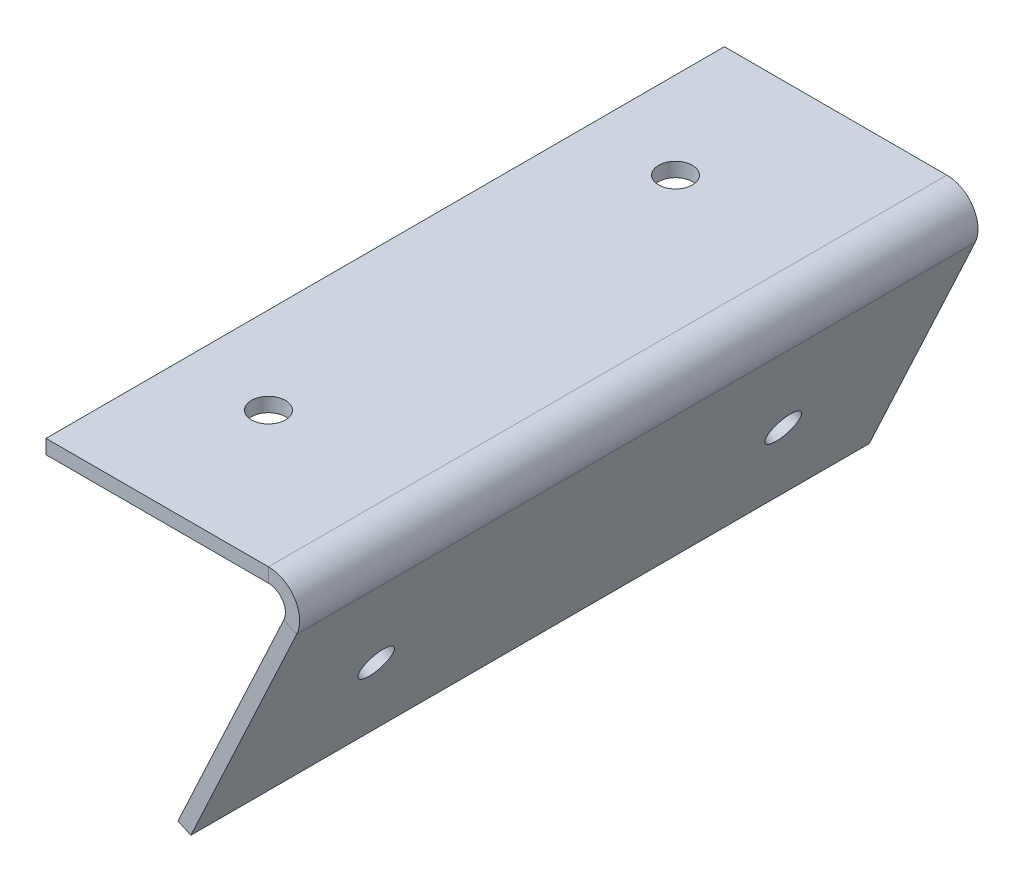
from build123d import *

# Parameters (mm, degrees)
BASE_FLANGE1_DEPTH = 127
CUT_EXTRUDE1_REACH = 146.789
SKETCH6_R          = 3.175
CUT_EXTRUDE2_REACH = 139.304
SKETCH7_R          = 3.175


# Read off the part's stored shape, not the designer's step: Base-Flange1
with BuildPart() as part:
    # Base-Flange1 outline → Base-Flange1 (new body)
    with BuildSketch(Plane.XY):
        with BuildLine():
            Line((44.523372088, -7.173652981), (24.703656185, -49.677170897))
            Line((24.703656185, -49.677170897), (27.111570966, -50.8))
            Line((27.111570966, -50.8), (46.931286869, -8.296482084))
            ThreePointArc((46.931286869, -8.296482084), (46.564368833, -2.698394652), (41.645844864, 0))
            Line((41.645844864, 0), (0, 0))
            Line((0, 0), (0, -2.65684))
            Line((0, -2.65684), (41.645844864, -2.65684))
            ThreePointArc((41.645844864, -2.65684), (44.323612704, -4.125913744), (44.523372088, -7.173652981))
        make_face()
    extrude(amount=BASE_FLANGE1_DEPTH)

    # Sketch6 → Cut-Extrude1 (cut, up to next)
    with BuildSketch(Plane(origin=(0, 0, 0), x_dir=(1, 0, 0), z_dir=(0, 1, 0)), mode=Mode.PRIVATE) as cut_extrude1_sk1:
        with Locations(Location((16.245844864, -101.6, 0), (0, 0, 270))):
            Circle(SKETCH6_R)
    cut_extrude1_tool1 = extrude(cut_extrude1_sk1.sketch, amount=-CUT_EXTRUDE1_REACH, mode=Mode.PRIVATE) & part.part
    # Sketch6 → Cut-Extrude1 (cut, up to next)
    with BuildSketch(Plane(origin=(0, 0, 0), x_dir=(1, 0, 0), z_dir=(0, 1, 0)), mode=Mode.PRIVATE) as cut_extrude1_sk2:
        with Locations(Location((16.245844864, -25.4, 0), (0, 0, 270))):
            Circle(SKETCH6_R)
    cut_extrude1_tool2 = extrude(cut_extrude1_sk2.sketch, amount=-CUT_EXTRUDE1_REACH, mode=Mode.PRIVATE) & part.part
    add(cut_extrude1_tool1.solids().sort_by_distance((16.245845, 0, 101.6))[0], mode=Mode.SUBTRACT)
    add(cut_extrude1_tool2.solids().sort_by_distance((16.245845, 0, 25.4))[0], mode=Mode.SUBTRACT)

    # Sketch7 → Cut-Extrude2 (cut, up to next)
    with BuildSketch(Plane(origin=(41.726805286, -19.457528855, 0), x_dir=(0, 0, -1), z_dir=(0.906307787036648, -0.4226182617407038, 0)), mode=Mode.PRIVATE) as cut_extrude2_sk1:
        with Locations(Location((-101.6, -12.580218597, 0), (0, 0, 90))):
            Circle(SKETCH7_R)
    cut_extrude2_tool1 = extrude(cut_extrude2_sk1.sketch, amount=-CUT_EXTRUDE2_REACH, mode=Mode.PRIVATE) & part.part
    # Sketch7 → Cut-Extrude2 (cut, up to next)
    with BuildSketch(Plane(origin=(41.726805286, -19.457528855, 0), x_dir=(0, 0, -1), z_dir=(0.906307787036648, -0.4226182617407038, 0)), mode=Mode.PRIVATE) as cut_extrude2_sk2:
        with Locations(Location((-25.4, -12.580218597, 0), (0, 0, 90))):
            Circle(SKETCH7_R)
    cut_extrude2_tool2 = extrude(cut_extrude2_sk2.sketch, amount=-CUT_EXTRUDE2_REACH, mode=Mode.PRIVATE) & part.part
    add(cut_extrude2_tool1.solids().sort_by_distance((36.410175, -30.859079, 101.6))[0], mode=Mode.SUBTRACT)
    add(cut_extrude2_tool2.solids().sort_by_distance((36.410175, -30.859079, 25.4))[0], mode=Mode.SUBTRACT)


solid = part.part
